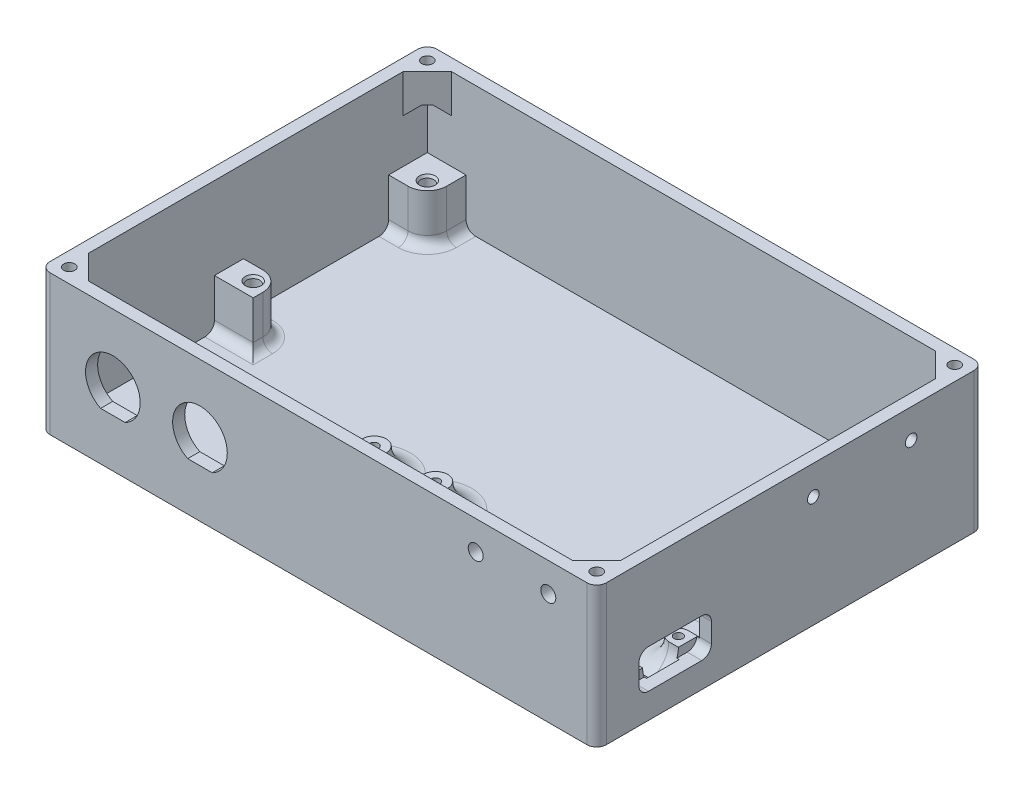
from build123d import *
from OCP.BRepFilletAPI import BRepFilletAPI_MakeChamfer

# Parameters (mm, degrees)
SKETCH1_W           = 115
SKETCH1_H           = 80
BOSS_EXTRUDE1_DEPTH = 2
SKETCH2_W           = 115
SKETCH2_H           = 80
SKETCH2_W_2         = 110
SKETCH2_H_2         = 75
EXTRUDE_THIN1_DEPTH = 27
SKETCH3_R           = 1.35
BOSS_EXTRUDE2_DEPTH = 10
FILLET1_R           = 2
SKETCH4_R           = 2
SKETCH4_R_2         = 0.9
SKETCH4_R_3         = 2.5
BOSS_EXTRUDE3_DEPTH = 5
SKETCH5_R           = 1.2
SKETCH5_W           = 15
SKETCH5_H           = 8
CUT_EXTRUDE1_DEPTH  = 3
CUT_EXTRUDE2_REACH  = 145.059
CUT_EXTRUDE3_REACH  = 145.059
SKETCH7_R           = 1.55
BOSS_EXTRUDE4_DEPTH = 6
FILLET2_SIZE        = 1.9
SKETCH9_R           = 1.15
CUT_EXTRUDE4_DEPTH  = 5
FILLET3_R           = 2
FILLET4_R           = 5
SKETCH11_R          = 2.7
SKETCH11_R_2        = 1.2
BOSS_EXTRUDE5_DEPTH = 1.7
FILLET5_R           = 2
FILLET6_R           = 2
FASE1_SIZE          = 0.3
FASE1_SIZE2         = 0.519615242


with BuildPart() as part:
    # Sketch1 → Boss-Extrude1 (new body)
    with BuildSketch(Plane(origin=(0, 0, 0), x_dir=(1, 0, 0), z_dir=(0, 1, 0))):
        with Locations((57.5, 40)):
            Rectangle(SKETCH1_W, SKETCH1_H)
    extrude(amount=BOSS_EXTRUDE1_DEPTH)

    # Sketch2 → Extrude-Thin1 (add)
    with BuildSketch(Plane(origin=(0, 2, 0), x_dir=(1, 0, 0), z_dir=(0, 1, 0))):
        with Locations((57.5, 40)):
            Rectangle(SKETCH2_W, SKETCH2_H)
        with Locations((57.5, 40)):
            Rectangle(SKETCH2_W_2, SKETCH2_H_2, mode=Mode.SUBTRACT)
    extrude(amount=EXTRUDE_THIN1_DEPTH)

    # Sketch3 → Boss-Extrude2 (add)
    # profile 1 of 4: a face of its own
    with BuildSketch(Plane(origin=(0, 2, 0), x_dir=(1, 0, 0), z_dir=(0, 1, 0))):
        with BuildLine():
            Line((2.5, 77.5), (10.5, 77.5))
            Line((10.5, 77.5), (10.5, 73.5))
            ThreePointArc((10.5, 73.5), (9.328427125, 70.671572875), (6.5, 69.5))
            Line((6.5, 69.5), (2.5, 69.5))
            Line((2.5, 69.5), (2.5, 77.5))
        make_face()
        with Locations(Location((7.5, 72.5, 0), (0, 0, 270))):
            Circle(SKETCH3_R, mode=Mode.SUBTRACT)
    # profile 2 of 4: a face of its own
    with BuildSketch(Plane(origin=(0, 2, 0), x_dir=(1, 0, 0), z_dir=(0, 1, 0))):
        with BuildLine():
            Line((2.5, 33.5), (10.5, 33.5))
            Line((10.5, 33.5), (10.5, 35.5))
            ThreePointArc((10.5, 35.5), (9.328427125, 38.328427125), (6.5, 39.5))
            Line((6.5, 39.5), (2.5, 39.5))
            Line((2.5, 39.5), (2.5, 33.5))
        make_face()
        with Locations(Location((7.5, 36.5, 0), (0, 0, 270))):
            Circle(SKETCH3_R, mode=Mode.SUBTRACT)
    # profile 3 of 4: a face of its own
    with BuildSketch(Plane(origin=(0, 2, 0), x_dir=(1, 0, 0), z_dir=(0, 1, 0))):
        with BuildLine():
            Line((99.5, 39.5), (103.5, 39.5))
            Line((103.5, 39.5), (103.5, 33.5))
            Line((103.5, 33.5), (95.5, 33.5))
            Line((95.5, 33.5), (95.5, 35.5))
            ThreePointArc((95.5, 35.5), (96.671572875, 38.328427125), (99.5, 39.5))
        make_face()
        with Locations(Location((98.5, 36.5, 0), (0, 0, 270))):
            Circle(SKETCH3_R, mode=Mode.SUBTRACT)
    # profile 4 of 4: a face of its own
    with BuildSketch(Plane(origin=(0, 2, 0), x_dir=(1, 0, 0), z_dir=(0, 1, 0))):
        with BuildLine():
            Line((95.5, 77.5), (103.5, 77.5))
            Line((103.5, 77.5), (103.5, 69.5))
            Line((103.5, 69.5), (99.5, 69.5))
            ThreePointArc((99.5, 69.5), (96.671572875, 70.671572875), (95.5, 73.5))
            Line((95.5, 73.5), (95.5, 77.5))
        make_face()
        with Locations(Location((98.5, 72.5, 0), (0, 0, 270))):
            Circle(SKETCH3_R, mode=Mode.SUBTRACT)
    extrude(amount=BOSS_EXTRUDE2_DEPTH)

    # Fillet1
    fillet1_edges = [part.edges().sort_by_distance(p)[0] for p in [
        (6.5, 2, -33.5),
        (10.5, 2, -34.5),
        (9.328427125, 2, -38.328427125),
        (4.5, 2, -39.5),
        (4.5, 2, -69.5),
        (9.328427125, 2, -70.671572875),
        (10.5, 2, -75.5),
        (103.5, 2, -36.5),
        (101.5, 2, -39.5),
        (96.671572875, 2, -38.328427125),
        (95.5, 2, -34.5),
        (99.5, 2, -33.5),
        (95.5, 2, -75.5),
        (96.671572875, 2, -70.671572875),
        (101.5, 2, -69.5),
        (103.5, 2, -73.5),
    ]]
    fillet(fillet1_edges, radius=FILLET1_R)

    # Sketch4 → Boss-Extrude3 (add)
    # profile 1 of 6: a face of its own
    with BuildSketch(Plane(origin=(0, 2, 0), x_dir=(1, 0, 0), z_dir=(0, 1, 0))):
        with Locations(Location((63, 21.9, 0), (0, 0, 90))):
            Circle(SKETCH4_R)
        with Locations(Location((63, 21.9, 0), (0, 0, 270))):
            Circle(SKETCH4_R_2, mode=Mode.SUBTRACT)
    # profile 2 of 6: a face of its own
    with BuildSketch(Plane(origin=(0, 2, 0), x_dir=(1, 0, 0), z_dir=(0, 1, 0))):
        with Locations(Location((63, 10.5, 0), (0, 0, 90))):
            Circle(SKETCH4_R)
        with Locations(Location((63, 10.5, 0), (0, 0, 270))):
            Circle(SKETCH4_R_2, mode=Mode.SUBTRACT)
    # profile 3 of 6: a face of its own
    with BuildSketch(Plane(origin=(0, 2, 0), x_dir=(1, 0, 0), z_dir=(0, 1, 0))):
        with Locations(Location((44.5, 24.5, 0), (0, 0, 90))):
            Circle(SKETCH4_R_3)
        with Locations(Location((44.5, 24.5, 0), (0, 0, 270))):
            Circle(SKETCH4_R_2, mode=Mode.SUBTRACT)
    # profile 4 of 6: a face of its own
    with BuildSketch(Plane(origin=(0, 2, 0), x_dir=(1, 0, 0), z_dir=(0, 1, 0))):
        with Locations(Location((57.2, 24.5, 0), (0, 0, 90))):
            Circle(SKETCH4_R_3)
        with Locations(Location((57.2, 24.5, 0), (0, 0, 270))):
            Circle(SKETCH4_R_2, mode=Mode.SUBTRACT)
    # profile 5 of 6: a face of its own
    with BuildSketch(Plane(origin=(0, 2, 0), x_dir=(1, 0, 0), z_dir=(0, 1, 0))):
        with BuildLine():
            Line((112.5, 23.9), (112.5, 19.9))
            Line((112.5, 19.9), (110, 19.9))
            ThreePointArc((110, 19.9), (108, 21.9), (110, 23.9))
            Line((110, 23.9), (112.5, 23.9))
        make_face()
        with Locations(Location((110, 21.9, 0), (0, 0, 270))):
            Circle(SKETCH4_R_2, mode=Mode.SUBTRACT)
    # profile 6 of 6: a face of its own
    with BuildSketch(Plane(origin=(0, 2, 0), x_dir=(1, 0, 0), z_dir=(0, 1, 0))):
        with BuildLine():
            Line((110, 8.5), (112.5, 8.5))
            Line((112.5, 8.5), (112.5, 12.5))
            Line((112.5, 12.5), (110, 12.5))
            ThreePointArc((110, 12.5), (108, 10.5), (110, 8.5))
        make_face()
        with Locations(Location((110, 10.5, 0), (0, 0, 90))):
            Circle(SKETCH4_R_2, mode=Mode.SUBTRACT)
    extrude(amount=BOSS_EXTRUDE3_DEPTH)

    # Sketch5 → Cut-Extrude1 (cut)
    with BuildSketch(Plane(origin=(115, 0, -120), x_dir=(0, 0, 1), z_dir=(-1, 0, 0))):
        with Locations((75.23, 23)):
            Circle(SKETCH5_R)
        with Locations((55, 23)):
            Circle(SKETCH5_R)
        with Locations((103.785, 9.215049253)):
            Rectangle(SKETCH5_W, SKETCH5_H)
    extrude(amount=CUT_EXTRUDE1_DEPTH, mode=Mode.SUBTRACT)

    # Sketch6 → Cut-Extrude2 (cut, up to next)
    with BuildSketch(Plane.XY, mode=Mode.PRIVATE) as cut_extrude2_sk1:
        with BuildLine():
            Line((12.466228108, 9.95), (17.533771892, 9.95))
            ThreePointArc((17.533771892, 9.95), (15, 20.65), (12.466228108, 9.95))
        make_face()
    cut_extrude2_tool1 = extrude(cut_extrude2_sk1.sketch, amount=-CUT_EXTRUDE2_REACH, mode=Mode.PRIVATE) & part.part
    # Sketch6 → Cut-Extrude2 (cut, up to next)
    with BuildSketch(Plane.XY, mode=Mode.PRIVATE) as cut_extrude2_sk2:
        with BuildLine():
            Line((30.466228108, 9.95), (35.533771892, 9.95))
            ThreePointArc((35.533771892, 9.95), (33, 20.65), (30.466228108, 9.95))
        make_face()
    cut_extrude2_tool2 = extrude(cut_extrude2_sk2.sketch, amount=-CUT_EXTRUDE2_REACH, mode=Mode.PRIVATE) & part.part
    add(cut_extrude2_tool1.solids().sort_by_distance((15, 15.110391, 0))[0], mode=Mode.SUBTRACT)
    add(cut_extrude2_tool2.solids().sort_by_distance((33, 15.110391, 0))[0], mode=Mode.SUBTRACT)

    # Sketch7 → Cut-Extrude3 (cut, up to next)
    with BuildSketch(Plane.XY, mode=Mode.PRIVATE) as cut_extrude3_sk1:
        with Locations((105, 23)):
            Circle(SKETCH7_R)
    cut_extrude3_tool1 = extrude(cut_extrude3_sk1.sketch, amount=-CUT_EXTRUDE3_REACH, mode=Mode.PRIVATE) & part.part
    # Sketch7 → Cut-Extrude3 (cut, up to next)
    with BuildSketch(Plane.XY, mode=Mode.PRIVATE) as cut_extrude3_sk2:
        with Locations((90, 23)):
            Circle(SKETCH7_R)
    cut_extrude3_tool2 = extrude(cut_extrude3_sk2.sketch, amount=-CUT_EXTRUDE3_REACH, mode=Mode.PRIVATE) & part.part
    add(cut_extrude3_tool1.solids().sort_by_distance((105, 23, 0))[0], mode=Mode.SUBTRACT)
    add(cut_extrude3_tool2.solids().sort_by_distance((90, 23, 0))[0], mode=Mode.SUBTRACT)

    # Sketch8 → Boss-Extrude4 (add)
    with BuildSketch(Plane(origin=(0, 29, 0), x_dir=(1, 0, 0), z_dir=(0, 1, 0))):
        Polygon((7.5, 77.5), (2.5, 72.5), (2.5, 77.5), align=None)
        Polygon((112.5, 77.5), (112.5, 72.5), (107.5, 77.5), align=None)
        Polygon((107.5, 2.5), (112.5, 7.5), (112.5, 2.5), align=None)
        Polygon((2.5, 2.5), (2.5, 7.5), (7.5, 2.5), align=None)
    extrude(amount=-BOSS_EXTRUDE4_DEPTH)

    # Fillet2
    fillet2_edges = [part.edges().sort_by_distance(p)[0] for p in [
        (5, 23, -77.5),
        (2.5, 23, -75),
        (110, 23, -77.5),
        (112.5, 23, -75),
        (110, 23, -2.5),
        (112.5, 23, -5),
        (5, 23, -2.5),
        (2.5, 23, -5),
    ]]
    chamfer(fillet2_edges, length=FILLET2_SIZE)

    # Sketch9 → Cut-Extrude4 (cut)
    with BuildSketch(Plane(origin=(0, 29, 0), x_dir=(1, 0, 0), z_dir=(0, 1, 0))):
        with Locations(Location((3, 77, 0), (0, 0, 270))):
            Circle(SKETCH9_R)
        with Locations(Location((112, 77, 0), (0, 0, 90))):
            Circle(SKETCH9_R)
        with Locations(Location((3, 3, 0), (0, 0, 90))):
            Circle(SKETCH9_R)
        with Locations(Location((112, 3, 0), (0, 0, 270))):
            Circle(SKETCH9_R)
    extrude(amount=-CUT_EXTRUDE4_DEPTH, mode=Mode.SUBTRACT)

    # Fillet3
    fillet3_edges = [part.edges().sort_by_distance(p)[0] for p in [
        (113.5, 5.215049253, -8.715),
        (113.75, 13.215049253, -8.715),
        (113.75, 13.215049253, -23.715),
        (113.5, 5.215049253, -23.715),
    ]]
    fillet(fillet3_edges, radius=FILLET3_R)

    # Fillet4
    # the kernel refuses this fillet: 5 mm, written as the material it adds along each edge
    with BuildSketch(Plane(origin=(44.5, 2, -24.5), x_dir=(0, 0, -1), z_dir=(1, 0, 0))) as fillet4_piece_1:
        with BuildLine():
            CenterArc((2.5 + FILLET4_R, FILLET4_R), FILLET4_R, 180, 90)
            Line((2.5, FILLET4_R), (2.5, 0))
            Line((2.5, 0), (2.5 + FILLET4_R, 0))
        make_face()
    revolve(axis=Axis((44.5, 2, -24.5), (0, 1, 0)))
    with BuildSketch(Plane(origin=(57.2, 2, -24.5), x_dir=(0, 0, -1), z_dir=(1, 0, 0))) as fillet4_piece_2_section:
        with BuildLine():
            CenterArc((2.5 + FILLET4_R, FILLET4_R), FILLET4_R, 180, 90)
            Line((2.5, FILLET4_R), (2.5, 0))
            Line((2.5, 0), (2.5 + FILLET4_R, 0))
        make_face()
    fillet4_piece_2 = revolve(axis=Axis((57.2, 2, -24.5), (0, 1, 0)), mode=Mode.PRIVATE)
    fillet4_piece_2 = fillet4_piece_2 - Plane(origin=(63, 3.429671868, -21.9), x_dir=(0, 0, 1), z_dir=(0, -1, 0)) * Cylinder(0.9, 30, mode=Mode.PRIVATE)
    add(fillet4_piece_2)
    with BuildSketch(Plane(origin=(63, 2, -10.5), x_dir=(0, 0, -1), z_dir=(1, 0, 0))) as fillet4_piece_3:
        with BuildLine():
            CenterArc((2 + FILLET4_R, FILLET4_R), FILLET4_R, 180, 90)
            Line((2, FILLET4_R), (2, 0))
            Line((2, 0), (2 + FILLET4_R, 0))
        make_face()
    revolve(axis=Axis((63, 2, -10.5), (0, 1, 0)))
    with BuildSketch(Plane(origin=(63, 2, -21.9), x_dir=(0, 0, -1), z_dir=(1, 0, 0))) as fillet4_piece_4_section:
        with BuildLine():
            CenterArc((2 + FILLET4_R, FILLET4_R), FILLET4_R, 180, 90)
            Line((2, FILLET4_R), (2, 0))
            Line((2, 0), (2 + FILLET4_R, 0))
        make_face()
    fillet4_piece_4 = revolve(axis=Axis((63, 2, -21.9), (0, 1, 0)), mode=Mode.PRIVATE)
    fillet4_piece_4 = fillet4_piece_4 - Plane(origin=(57.2, 3.431428768, -24.5), x_dir=(0, 0, 1), z_dir=(0, -1, 0)) * Cylinder(0.9, 28, mode=Mode.PRIVATE)
    add(fillet4_piece_4)
    with BuildSketch(Plane(origin=(112.5, 2, -12.5), x_dir=(0, 0, -1), z_dir=(-1, 0, 0))) as fillet4_piece_5_section:
        with BuildLine():
            CenterArc((FILLET4_R, -FILLET4_R), FILLET4_R, 90, 90)
            Line((0, -FILLET4_R), (0, 0))
            Line((0, 0), (FILLET4_R, 0))
        make_face()
    fillet4_piece_5 = extrude(amount=2.5, mode=Mode.PRIVATE)
    fillet4_piece_5 = split(fillet4_piece_5, bisect_by=Plane(origin=(112.25, 5.215049253, -13.654923706), z_dir=(0, -1, 0)), keep=Keep.TOP, mode=Mode.PRIVATE)
    add(fillet4_piece_5)
    with BuildSketch(Plane(origin=(125, 2, -12.5), x_dir=(0, 0, -1), z_dir=(-1, 0, 0))) as fillet4_piece_6_section:
        with BuildLine():
            CenterArc((FILLET4_R, -FILLET4_R), FILLET4_R, 90, 90)
            Line((0, -FILLET4_R), (0, 0))
            Line((0, 0), (FILLET4_R, 0))
        make_face()
    fillet4_piece_6 = extrude(amount=15, mode=Mode.PRIVATE)
    fillet4_piece_6 = split(fillet4_piece_6, bisect_by=Plane(origin=(112, 5.658293624, -12.598253345), z_dir=(-1, 0, 0)), keep=Keep.TOP, mode=Mode.PRIVATE)
    add(fillet4_piece_6)
    with BuildSketch(Plane(origin=(110, 2, -8.5), x_dir=(0, 0, 1), z_dir=(1, 0, 0))) as fillet4_piece_7_section:
        with BuildLine():
            CenterArc((FILLET4_R, -FILLET4_R), FILLET4_R, 90, 90)
            Line((0, -FILLET4_R), (0, 0))
            Line((0, 0), (FILLET4_R, 0))
        make_face()
    fillet4_piece_7 = extrude(amount=15, mode=Mode.PRIVATE)
    fillet4_piece_7 = split(fillet4_piece_7, bisect_by=Plane(origin=(115, 3.116839695, -7.383160305), z_dir=(-1, 0, 0)), keep=Keep.TOP, mode=Mode.PRIVATE)
    add(fillet4_piece_7)
    with BuildSketch(Plane(origin=(110, 2, -23.9), x_dir=(0, 1, 0), z_dir=(1, 0, 0))) as fillet4_piece_8_section:
        with BuildLine():
            CenterArc((FILLET4_R, -FILLET4_R), FILLET4_R, 90, 90)
            Line((0, -FILLET4_R), (0, 0))
            Line((0, 0), (FILLET4_R, 0))
        make_face()
    fillet4_piece_8 = extrude(amount=15, mode=Mode.PRIVATE)
    fillet4_piece_8 = split(fillet4_piece_8, bisect_by=Plane(origin=(115, 3.116839695, -25.016839695), z_dir=(-1, 0, 0)), keep=Keep.TOP, mode=Mode.PRIVATE)
    add(fillet4_piece_8)
    with BuildSketch(Plane(origin=(112.5, 2, -19.9), x_dir=(0, 0, 1), z_dir=(-1, 0, 0))) as fillet4_piece_9_section:
        with BuildLine():
            CenterArc((FILLET4_R, FILLET4_R), FILLET4_R, 180, 90)
            Line((0, FILLET4_R), (0, 0))
            Line((0, 0), (FILLET4_R, 0))
        make_face()
    fillet4_piece_9 = extrude(amount=2.5, mode=Mode.PRIVATE)
    fillet4_piece_9 = split(fillet4_piece_9, bisect_by=Plane(origin=(112.25, 5.215049253, -18.745076294), z_dir=(0, -1, 0)), keep=Keep.TOP, mode=Mode.PRIVATE)
    add(fillet4_piece_9)
    with BuildSketch(Plane(origin=(125, 2, -19.9), x_dir=(0, 0, 1), z_dir=(-1, 0, 0))) as fillet4_piece_10_section:
        with BuildLine():
            CenterArc((FILLET4_R, FILLET4_R), FILLET4_R, 180, 90)
            Line((0, FILLET4_R), (0, 0))
            Line((0, 0), (FILLET4_R, 0))
        make_face()
    fillet4_piece_10 = extrude(amount=15, mode=Mode.PRIVATE)
    fillet4_piece_10 = split(fillet4_piece_10, bisect_by=Plane(origin=(112, 5.658293624, -19.801746655), z_dir=(-1, 0, 0)), keep=Keep.TOP, mode=Mode.PRIVATE)
    add(fillet4_piece_10)
    with BuildSketch(Plane(origin=(110, 2, -10.5), x_dir=(0, 0, -1), z_dir=(1, 0, 0))) as fillet4_piece_11:
        with BuildLine():
            CenterArc((2 + FILLET4_R, FILLET4_R), FILLET4_R, 180, 90)
            Line((2, FILLET4_R), (2, 0))
            Line((2, 0), (2 + FILLET4_R, 0))
        make_face()
    revolve(axis=Axis((110, 2, -10.5), (0, 1, 0)), revolution_arc=180)
    with BuildSketch(Plane(origin=(110, 2, -21.9), x_dir=(0, 0, 1), z_dir=(1, 0, 0))) as fillet4_piece_12:
        with BuildLine():
            CenterArc((2 + FILLET4_R, -FILLET4_R), FILLET4_R, 90, 90)
            Line((2, -FILLET4_R), (2, 0))
            Line((2, 0), (2 + FILLET4_R, 0))
        make_face()
    revolve(axis=Axis((110, 2, -21.9), (0, -1, 0)), revolution_arc=180)

    # Sketch11 → Boss-Extrude5 (add)
    # profile 1 of 2: a face of its own
    with BuildSketch(Plane.ZY.offset(-112.5)):
        with Locations((-65, 23)):
            Circle(SKETCH11_R)
        with Locations((-65, 23)):
            Circle(SKETCH11_R_2, mode=Mode.SUBTRACT)
    # profile 2 of 2: a face of its own
    with BuildSketch(Plane.ZY.offset(-112.5)):
        with Locations((-44.77, 23)):
            Circle(SKETCH11_R)
        with Locations((-44.77, 23)):
            Circle(SKETCH11_R_2, mode=Mode.SUBTRACT)
    extrude(amount=BOSS_EXTRUDE5_DEPTH)

    # Fillet5
    # the kernel refuses this fillet: 2 mm, written as the material it adds along each edge
    with BuildSketch(Plane(origin=(112.5, 23, -65), x_dir=(0, 0, 1), z_dir=(0, -1, 0))) as fillet5_piece_1:
        with BuildLine():
            CenterArc((4.677371993, 2), FILLET5_R, 188.626926559, 81.373073441)
            Line((4.677371993, 0), (4.677371993, -0.04))
            Line((4.677371993, -0.04), (2.7, -0.04))
            Line((2.7, -0.04), (2.66, 0))
            ThreePointArc((2.66, 0), (2.66, 0.85), (2.66045256, 1.694))
            Line((2.66045256, 1.694), (2.7, 1.7))
        make_face()
    revolve(axis=Axis((112.5, 23, -65), (-1, 0, 0)))
    with BuildSketch(Plane(origin=(112.5, 23, -44.77), x_dir=(0, 0, 1), z_dir=(0, -1, 0))) as fillet5_piece_2:
        with BuildLine():
            CenterArc((4.677371993, 2), FILLET5_R, 188.626926559, 81.373073441)
            Line((4.677371993, 0), (4.677371993, -0.04))
            Line((4.677371993, -0.04), (2.7, -0.04))
            Line((2.7, -0.04), (2.66, 0))
            ThreePointArc((2.66, 0), (2.66, 0.85), (2.66045256, 1.694))
            Line((2.66045256, 1.694), (2.7, 1.7))
        make_face()
    revolve(axis=Axis((112.5, 23, -44.77), (-1, 0, 0)))

    # Fillet6
    fillet6_edges = [part.edges().sort_by_distance(p)[0] for p in [
        (0, 14.5, -80),
        (115, 14.5, -80),
        (115, 14.5, 0),
        (0, 14.5, 0),
    ]]
    fillet(fillet6_edges, radius=FILLET6_R)

    # Fase1: one chamfer whose edges measure the first distance from different faces: ONE call of the kernel's chamfer builder (chamfer() names one face for all edges)
    fase1_edges_1 = [part.edges().sort_by_distance(p)[0] for p in [
        (7.5, 12, -37.85),
    ]]
    fase1_side_1 = [part.faces().sort_by_distance(p)[0] for p in [
        (6.077964108, 12, -36.313777421),
    ]]
    fase1_edges_2 = [part.edges().sort_by_distance(p)[0] for p in [
        (7.5, 12, -73.85),
    ]]
    fase1_side_2 = [part.faces().sort_by_distance(p)[0] for p in [
        (6.201094552, 12, -73.798905448),
    ]]
    fase1_edges_3 = [part.edges().sort_by_distance(p)[0] for p in [
        (98.5, 12, -37.85),
    ]]
    fase1_side_3 = [part.faces().sort_by_distance(p)[0] for p in [
        (99.922035892, 12, -36.313777421),
    ]]
    fase1_edges_4 = [part.edges().sort_by_distance(p)[0] for p in [
        (98.5, 12, -73.85),
    ]]
    fase1_side_4 = [part.faces().sort_by_distance(p)[0] for p in [
        (99.798905448, 12, -73.798905448),
    ]]
    fase1 = BRepFilletAPI_MakeChamfer(part.part.solid().wrapped)
    for e in fase1_edges_1:
        fase1.Add(FASE1_SIZE, FASE1_SIZE2, e.wrapped, fase1_side_1[0].wrapped)  # the first distance lies on this face
    for e in fase1_edges_2:
        fase1.Add(FASE1_SIZE, FASE1_SIZE2, e.wrapped, fase1_side_2[0].wrapped)  # the first distance lies on this face
    for e in fase1_edges_3:
        fase1.Add(FASE1_SIZE, FASE1_SIZE2, e.wrapped, fase1_side_3[0].wrapped)  # the first distance lies on this face
    for e in fase1_edges_4:
        fase1.Add(FASE1_SIZE, FASE1_SIZE2, e.wrapped, fase1_side_4[0].wrapped)  # the first distance lies on this face
    add(Compound.cast(fase1.Shape()), mode=Mode.REPLACE)


solid = part.part
